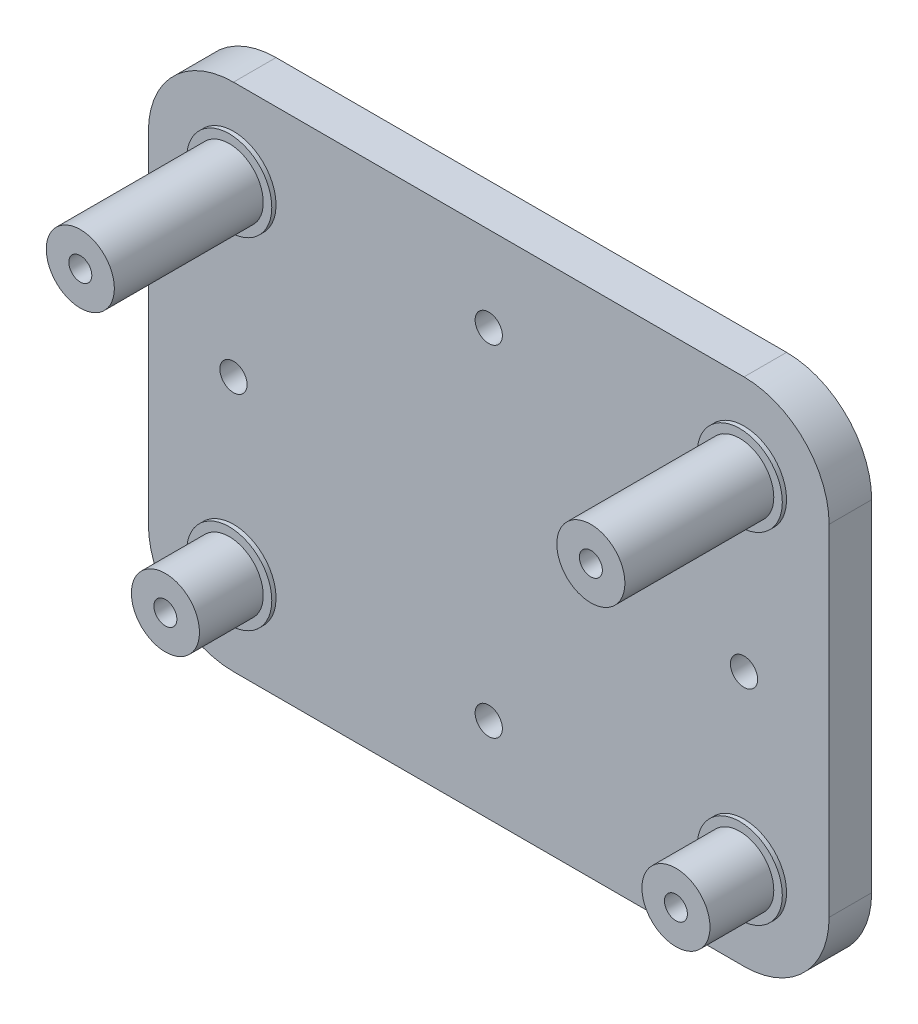
from build123d import *

# Parameters (mm, degrees)
SKETCH1_W               = 80
SKETCH1_H               = 60
BOSS_EXTRUDE1_DEPTH     = 5
SKETCH1_3_R             = 4
SKETCH1_3_R_2           = 1.35
BOSS_EXTRUDE2_DEPTH     = 8
SKETCH1_5_R             = 4
SKETCH1_5_R_2           = 1.35
BOSS_EXTRUDE4_DEPTH     = 18
SKETCH1_4_R             = 5
SKETCH1_4_R_2           = 4
BOSS_EXTRUDE3_DEPTH     = 0.5
CUT_EXTRUDE1_DEPTH      = 54.141321022
CUT_EXTRUDE1_DEPTH_BACK = 54.141321022
SKETCH1_6_R             = 1.6
FILLET1_R               = 10


with BuildPart() as part:
    # Sketch1 → Boss-Extrude1 (new body)
    with BuildSketch(Plane.XY):
        Rectangle(SKETCH1_W, SKETCH1_H)
    extrude(amount=-BOSS_EXTRUDE1_DEPTH)

    # Sketch1<3> → Boss-Extrude2 (add)
    # profile 1 of 2: a face of its own
    with BuildSketch(Plane.XY):
        with Locations((-30, -20)):
            Circle(SKETCH1_3_R)
        with Locations((-30, -20)):
            Circle(SKETCH1_3_R_2, mode=Mode.SUBTRACT)
    # profile 2 of 2: a face of its own
    with BuildSketch(Plane.XY):
        with Locations((30, -20)):
            Circle(SKETCH1_3_R)
        with Locations((30, -20)):
            Circle(SKETCH1_3_R_2, mode=Mode.SUBTRACT)
    extrude(amount=BOSS_EXTRUDE2_DEPTH)

    # Sketch1<5> → Boss-Extrude4 (add)
    # profile 1 of 2: a face of its own
    with BuildSketch(Plane.XY):
        with Locations((-30, 20)):
            Circle(SKETCH1_5_R)
        with Locations((-30, 20)):
            Circle(SKETCH1_5_R_2, mode=Mode.SUBTRACT)
    # profile 2 of 2: a face of its own
    with BuildSketch(Plane.XY):
        with Locations((30, 20)):
            Circle(SKETCH1_5_R)
        with Locations((30, 20)):
            Circle(SKETCH1_5_R_2, mode=Mode.SUBTRACT)
    extrude(amount=BOSS_EXTRUDE4_DEPTH)

    # Sketch1<4> → Boss-Extrude3 (add)
    # profile 1 of 4: a face of its own
    with BuildSketch(Plane.XY):
        with Locations((-30, 20)):
            Circle(SKETCH1_4_R)
        with Locations((-30, 20)):
            Circle(SKETCH1_4_R_2, mode=Mode.SUBTRACT)
    # profile 2 of 4: a face of its own
    with BuildSketch(Plane.XY):
        with Locations((30, 20)):
            Circle(SKETCH1_4_R)
        with Locations((30, 20)):
            Circle(SKETCH1_4_R_2, mode=Mode.SUBTRACT)
    # profile 3 of 4: a face of its own
    with BuildSketch(Plane.XY):
        with Locations((30, -20)):
            Circle(SKETCH1_4_R)
        with Locations((30, -20)):
            Circle(SKETCH1_4_R_2, mode=Mode.SUBTRACT)
    # profile 4 of 4: a face of its own
    with BuildSketch(Plane.XY):
        with Locations((-30, -20)):
            Circle(SKETCH1_4_R)
        with Locations((-30, -20)):
            Circle(SKETCH1_4_R_2, mode=Mode.SUBTRACT)
    extrude(amount=BOSS_EXTRUDE3_DEPTH)

    # Sketch1<6> → Cut-Extrude1 (cut, two sides: drawn at the far end of the back side and taken through both)
    with BuildSketch(Plane.XY.offset(-CUT_EXTRUDE1_DEPTH_BACK)):
        with Locations((-30, 0)):
            Circle(SKETCH1_6_R)
        with Locations((0, 20)):
            Circle(SKETCH1_6_R)
        with Locations((30, 0)):
            Circle(SKETCH1_6_R)
        with Locations((0, -20)):
            Circle(SKETCH1_6_R)
    extrude(amount=CUT_EXTRUDE1_DEPTH + CUT_EXTRUDE1_DEPTH_BACK, mode=Mode.SUBTRACT)

    # Fillet1
    fillet1_edges = [part.edges().sort_by_distance(p)[0] for p in [
        (40, 30, -2.5),
        (40, -30, -2.5),
        (-40, -30, -2.5),
        (-40, 30, -2.5),
    ]]
    fillet(fillet1_edges, radius=FILLET1_R)


solid = part.part
